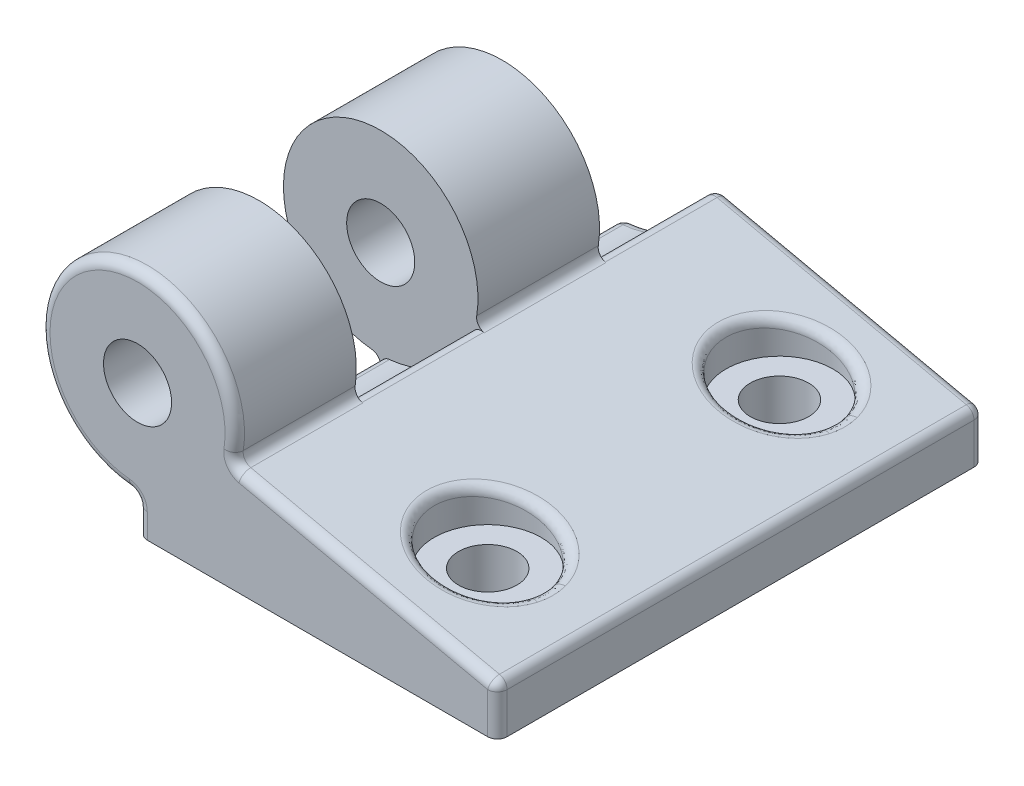
from build123d import *

# Parameters (mm, degrees)
SKETCH1_R           = 3.5
BOSS_EXTRUDE1_DEPTH = 25
SKETCH2_R           = 3
CUT_EXTRUDE1_DEPTH  = 51.460380498
SKETCH3_R           = 5.5
CUT_EXTRUDE2_DEPTH  = 49.334770094
SKETCH5_W           = 10
SKETCH5_H           = 12.5
FILLET3_R           = 1
FILLET4_R           = 1


with BuildPart() as part:
    # Sketch1 → Boss-Extrude1 (new, symmetric)
    with BuildSketch(Plane.XY):
        with BuildLine():
            Line((0, -13.5), (37, -13.5))
            Line((37, -13.5), (37, -8.5))
            Line((37, -8.5), (9.682458366, -2.5))
            ThreePointArc((9.682458366, -2.5), (-6.123724357, 7.90569415), (0, -10))
            Line((0, -10), (0, -13.5))
        make_face()
        Circle(SKETCH1_R, mode=Mode.SUBTRACT)
    extrude(amount=BOSS_EXTRUDE1_DEPTH, both=True)

    # Sketch2 → Cut-Extrude1 (cut, through all)
    with BuildSketch(Plane.XZ.offset(13.5)):
        with Locations((26, 15)):
            Circle(SKETCH2_R)
        with Locations((26, -15)):
            Circle(SKETCH2_R)
    extrude(amount=-CUT_EXTRUDE1_DEPTH, mode=Mode.SUBTRACT)

    # Sketch3 → Cut-Extrude2 (cut, through all)
    with BuildSketch(Plane(origin=(0, -8.5, 0), x_dir=(-1, 0, 0), z_dir=(0, -1, 0))):
        with Locations((-26, 15)):
            Circle(SKETCH3_R)
        with Locations((-26, -15)):
            Circle(SKETCH3_R)
    extrude(amount=-CUT_EXTRUDE2_DEPTH, mode=Mode.SUBTRACT)

    # Sketch5 → Cut-Revolve1 (revolve, cut)
    with BuildSketch(Plane(origin=(0, 0, 0), x_dir=(1, 0, 0), z_dir=(0, 1, 0))):
        with Locations((-5, 18.75)):
            Rectangle(SKETCH5_W, SKETCH5_H)
        with Locations((-5, -6.25)):
            Rectangle(SKETCH5_W, SKETCH5_H)
    revolve(axis=Axis((0, 0, -25), (0, 0, 1)), mode=Mode.SUBTRACT)

    # Fillet3
    fillet3_edges = [part.edges().sort_by_distance(p)[0] for p in [
        (0, -10, -6.25),
        (0, -10, 18.75),
        (9.682458366, -2.5, -6.25),
        (9.682458366, -2.5, 18.75),
    ]]
    fillet(fillet3_edges, radius=FILLET3_R)

    # Fillet4
    fillet4_edges = [part.edges().sort_by_distance(p)[0] for p in [
        (0, -12.227225575, 25),
        (-0.261451054, -10.280251288, 25),
        (-6.136482738, 7.895795058, 25),
        (10.03584865, -2.298357368, 25),
        (0, -10, -18.75),
        (0, -11.75, -25),
        (23.341229183, -5.5, -25),
        (6.123724357, -7.90569415, -25),
        (9.682458366, -2.5, -18.75),
        (37, -11, -25),
        (37, -11, 25),
        (37, -8.5, 0),
        (31.5, -7.291985002, -15.00000132),
        (31.5, -7.291985002, 14.99999868),
        (23.823868621, -5.606006487, 25),
        (0, -10, 6.25),
        (9.682458366, -2.5, 6.25),
    ]]
    fillet(fillet4_edges, radius=FILLET4_R)


solid = part.part
